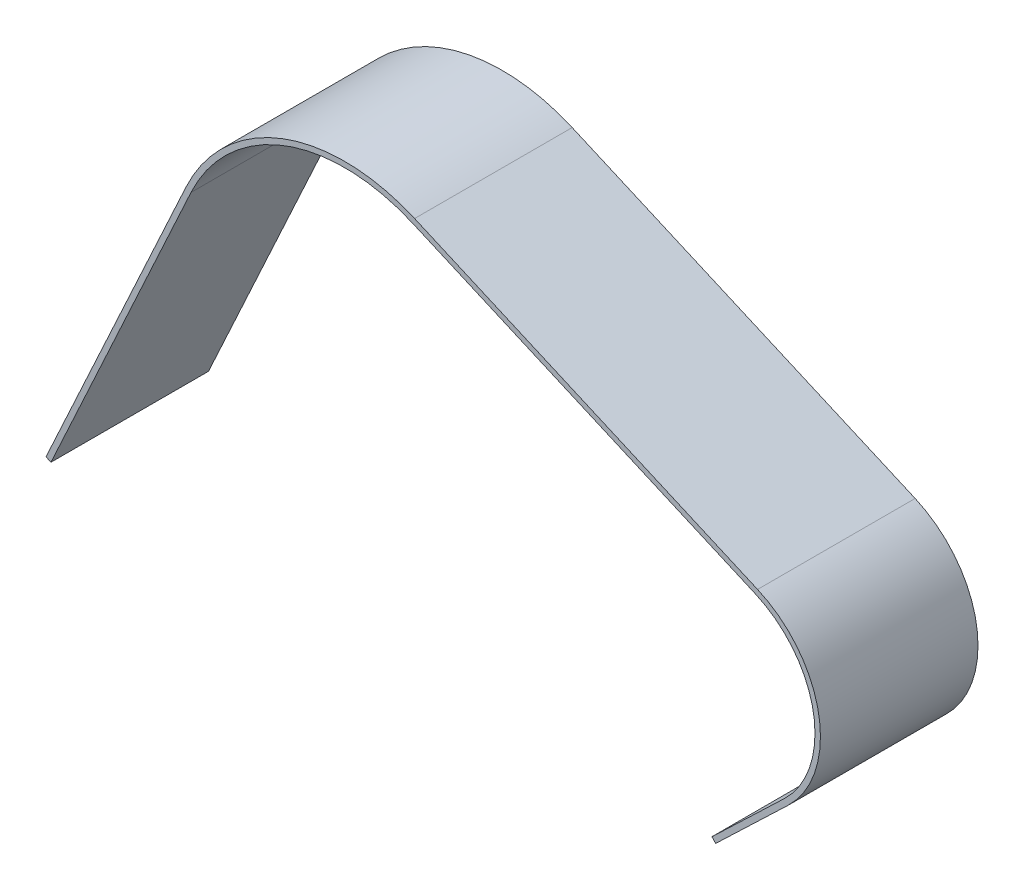
from build123d import *

# Parameters (mm, degrees)
BOSS_EXTRUDE1_DEPTH = 101.6


with BuildPart() as part:
    # Sketch1 → Boss-Extrude1 (new body)
    with BuildSketch(Plane.XY):
        with BuildLine():
            Line((-431.8, 0), (-341.502142753, 195.811952847))
            ThreePointArc((-341.502142753, 195.811952847), (-279.259788397, 253.929830956), (-194.12680681, 251.88682392))
            Line((-194.12680681, 251.88682392), (27.023962665, 155.356895087))
            ThreePointArc((27.023962665, 155.356895087), (66.513708041, 105.248558895), (46.677151191, 44.611966329))
            Line((46.677151191, 44.611966329), (0.001241582, -0.003476364))
            Line((0.001241582, -0.003476364), (0, 0))
            Line((0, 0), (-2.421715619, 2.533557273))
            Line((-2.421715619, 2.533557273), (44.253106378, 47.147960365))
            ThreePointArc((44.253106378, 47.147960365), (63.059508184, 104.635564316), (25.620550185, 152.141666881))
            Line((25.620550185, 152.141666881), (-195.53021929, 248.671595715))
            ThreePointArc((-195.53021929, 248.671595715), (-278.012219622, 250.650984946), (-338.316390779, 194.342856743))
            Line((-338.316390779, 194.342856743), (-428.614248025, -1.469096104))
            Line((-428.614248025, -1.469096104), (-431.8, 0))
        make_face()
    extrude(amount=BOSS_EXTRUDE1_DEPTH)


solid = part.part
